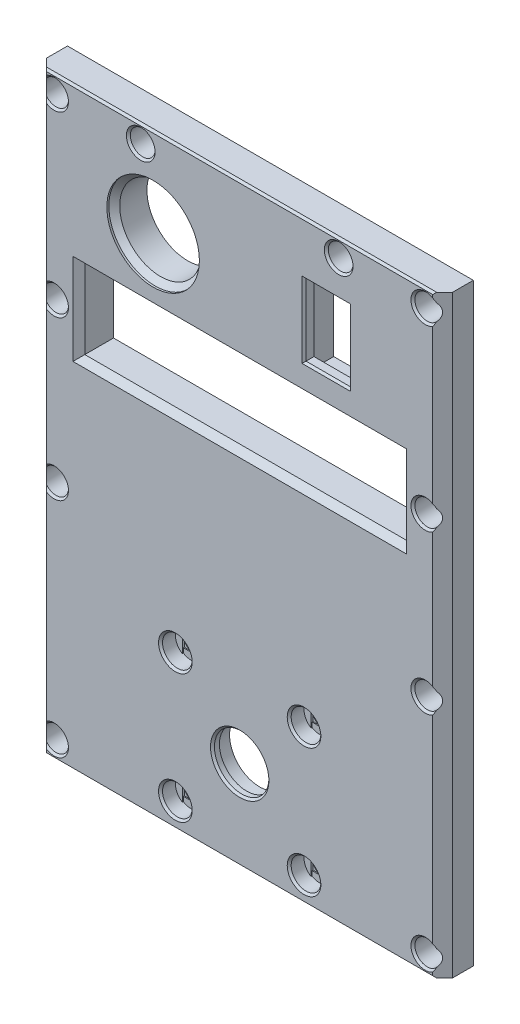
from build123d import *
from build123d.topology import SkipClean

# Parameters (mm, degrees)
SKETCH1_W                = 82
SKETCH1_H                = 120
SKETCH1_W_2              = 68
SKETCH1_H_2              = 106
BOSS_EXTRUDE1_DEPTH      = 7
SKETCH2_W                = 68
SKETCH2_H                = 36
BOSS_EXTRUDE2_DEPTH      = 7
SKETCH3_R                = 5.5
CUT_EXTRUDE1_DEPTH       = 74.006848994
SKETCH4_R                = 6.05
CUT_EXTRUDE2_DEPTH       = 5.6
SKETCH5_R                = 11
CUT_EXTRUDE3_DEPTH       = 3
SKETCH6_R                = 1.6
CUT_EXTRUDE4_DEPTH       = 74.006848994
SKETCH7_W                = 50
SKETCH7_H                = 38
CUT_EXTRUDE5_DEPTH       = 1
SKETCH8_R                = 3
CUT_EXTRUDE6_DEPTH       = 3
SKETCH9_R                = 1.5
CUT_EXTRUDE7_DEPTH       = 74.006848994
SKETCH10_R               = 2.5
CUT_EXTRUDE8_DEPTH       = 5
CHAMFER1_SIZE            = 2
SKETCH11_W               = 68
SKETCH11_H               = 19
BOSS_EXTRUDE3_DEPTH      = 7
SKETCH12_R               = 1.5
CUT_EXTRUDE9_DEPTH       = 74.006848994
SKETCH13_R               = 2.5
CUT_EXTRUDE10_DEPTH      = 5
CHAMFER2_SIZE            = 0.8
CUT_EXTRUDE11_DEPTH      = 0.2
SKETCH15_W               = 3
SKETCH15_H               = 3
CUT_EXTRUDE12_DEPTH      = 0.2
CUT_EXTRUDE13_DEPTH      = 0.2
SKETCH17_W               = 3.2
SKETCH17_H               = 3.2
CUT_EXTRUDE14_DEPTH      = 0.2
SKETCH18_W               = 69.6
SKETCH18_H               = 52.6
BOSS_EXTRUDE4_DEPTH      = 7
CUT_EXTRUDE15_DEPTH      = 74.006848994
CUT_EXTRUDE15_DEPTH_BACK = 74.006848994
SKETCH19_R               = 8.25
SKETCH19_W               = 9
SKETCH19_H               = 14.5
SKETCH20_W               = 11
SKETCH20_H               = 20.5
CUT_EXTRUDE16_DEPTH      = 5
SKETCH21_W               = 65
SKETCH21_H               = 16
CUT_EXTRUDE17_DEPTH      = 74.006848994
SKETCH22_R               = 9.35
CUT_EXTRUDE18_DEPTH      = 1.6
CHAMFER3_SIZE            = 1.2
CHAMFER4_SIZE            = 1.2
CHAMFER5_SIZE            = 0.4
CHAMFER6_SIZE            = 0.4


with BuildPart() as part:
    # Sketch1 → Boss-Extrude1 (new body)
    with BuildSketch(Plane.XY):
        Rectangle(SKETCH1_W, SKETCH1_H)
        Rectangle(SKETCH1_W_2, SKETCH1_H_2, mode=Mode.SUBTRACT)
    extrude(amount=BOSS_EXTRUDE1_DEPTH)

    # Sketch2 → Boss-Extrude2 (add)
    with BuildSketch(Plane.XY.offset(7)):
        with Locations((0, -35)):
            Rectangle(SKETCH2_W, SKETCH2_H)
    extrude(amount=-BOSS_EXTRUDE2_DEPTH)

    # Sketch3 → Cut-Extrude1 (cut, through all)
    with BuildSketch(Plane(origin=(0, 0, 0), x_dir=(-1, 0, 0), z_dir=(0, 0, -1))):
        with Locations((0, -42)):
            Circle(SKETCH3_R)
    extrude(amount=-CUT_EXTRUDE1_DEPTH, mode=Mode.SUBTRACT)

    # Sketch4 → Cut-Extrude2 (cut)
    with BuildSketch(Plane(origin=(0, 0, 0), x_dir=(-1, 0, 0), z_dir=(0, 0, -1))):
        with Locations((0, -42)):
            Circle(SKETCH4_R)
    extrude(amount=-CUT_EXTRUDE2_DEPTH, mode=Mode.SUBTRACT)

    # Sketch5 → Cut-Extrude3 (cut)
    with BuildSketch(Plane(origin=(0, 0, 0), x_dir=(-1, 0, 0), z_dir=(0, 0, -1))):
        with Locations((0, -42)):
            Circle(SKETCH5_R)
    extrude(amount=-CUT_EXTRUDE3_DEPTH, mode=Mode.SUBTRACT)

    # Sketch6 → Cut-Extrude4 (cut, through all)
    with BuildSketch(Plane(origin=(0, 0, 0), x_dir=(-1, 0, 0), z_dir=(0, 0, -1))):
        with Locations((-13, -29)):
            Circle(SKETCH6_R)
        with Locations((13, -29)):
            Circle(SKETCH6_R)
        with Locations((13, -55)):
            Circle(SKETCH6_R)
        with Locations((-13, -55)):
            Circle(SKETCH6_R)
    extrude(amount=-CUT_EXTRUDE4_DEPTH, mode=Mode.SUBTRACT)

    # Sketch7 → Cut-Extrude5 (cut)
    with BuildSketch(Plane(origin=(0, 0, 0), x_dir=(-1, 0, 0), z_dir=(0, 0, -1))):
        with Locations((0, -42)):
            Rectangle(SKETCH7_W, SKETCH7_H)
    extrude(amount=-CUT_EXTRUDE5_DEPTH, mode=Mode.SUBTRACT)

    # Sketch8 → Cut-Extrude6 (cut)
    with BuildSketch(Plane.XY.offset(7)):
        with Locations((-13, -29)):
            Circle(SKETCH8_R)
        with Locations((13, -29)):
            Circle(SKETCH8_R)
        with Locations((13, -55)):
            Circle(SKETCH8_R)
        with Locations((-13, -55)):
            Circle(SKETCH8_R)
    extrude(amount=-CUT_EXTRUDE6_DEPTH, mode=Mode.SUBTRACT)

    # Sketch9 → Cut-Extrude7 (cut, through all)
    with BuildSketch(Plane.XY.offset(7)):
        with Locations((-37.5, 56.5)):
            Circle(SKETCH9_R)
        with Locations((37.5, 56.5)):
            Circle(SKETCH9_R)
        with Locations((-37.5, -56.5)):
            Circle(SKETCH9_R)
        with Locations((37.5, -56.5)):
            Circle(SKETCH9_R)
        with Locations((-37.5, 20.5)):
            Circle(SKETCH9_R)
        with Locations((37.5, 20.5)):
            Circle(SKETCH9_R)
        with Locations((37.5, -11.5)):
            Circle(SKETCH9_R)
        with Locations((-37.5, -11.5)):
            Circle(SKETCH9_R)
    extrude(amount=-CUT_EXTRUDE7_DEPTH, mode=Mode.SUBTRACT)

    # Sketch10 → Cut-Extrude8 (cut)
    with BuildSketch(Plane.XY.offset(7)):
        with Locations((-37.5, 56.5)):
            Circle(SKETCH10_R)
        with Locations((37.5, 20.5)):
            Circle(SKETCH10_R)
        with Locations((-37.5, 20.5)):
            Circle(SKETCH10_R)
        with Locations((37.5, 56.5)):
            Circle(SKETCH10_R)
        with Locations((-37.5, -56.5)):
            Circle(SKETCH10_R)
        with Locations((37.5, -56.5)):
            Circle(SKETCH10_R)
        with Locations((-37.5, -11.5)):
            Circle(SKETCH10_R)
        with Locations((37.5, -11.5)):
            Circle(SKETCH10_R)
    extrude(amount=-CUT_EXTRUDE8_DEPTH, mode=Mode.SUBTRACT)

    # Chamfer1
    # the kernel refuses this chamfer: 2 mm, written as the material it takes off along each edge
    with BuildSketch(Plane(origin=(-41, 65.143365976, 7), x_dir=(0.9996219169112968, 0, 0.02749587661058651), z_dir=(0, -1, 0))) as chamfer1_piece_1:
        Polygon((CHAMFER1_SIZE * 0.999621916911, -CHAMFER1_SIZE * 0.0274958766106), (-CHAMFER1_SIZE * 0.0274958766106, -CHAMFER1_SIZE * 0.999621916911), (0, 0), align=None)
    extrude(amount=130.286731952, mode=Mode.SUBTRACT)
    with BuildSketch(Plane(origin=(41, -65.143365976, 7), x_dir=(0.027495876610585623, 0, -0.9996219169112968), z_dir=(0, 1, 0))) as chamfer1_piece_2:
        Polygon((CHAMFER1_SIZE * 0.999621916911, CHAMFER1_SIZE * 0.0274958766106), (-CHAMFER1_SIZE * 0.0274958766106, CHAMFER1_SIZE * 0.999621916911), (0, 0), align=None)
    extrude(amount=130.286731952, mode=Mode.SUBTRACT)

    # Sketch11 → Boss-Extrude3 (add)
    with BuildSketch(Plane.XY.offset(7)):
        with Locations((0, -7.5)):
            Rectangle(SKETCH11_W, SKETCH11_H)
    extrude(amount=-BOSS_EXTRUDE3_DEPTH)

    # Sketch12 → Cut-Extrude9 (cut, through all)
    with BuildSketch(Plane.XY.offset(7)):
        with Locations((-20, 56.5)):
            Circle(SKETCH12_R)
        with Locations((20, 56.5)):
            Circle(SKETCH12_R)
    extrude(amount=-CUT_EXTRUDE9_DEPTH, mode=Mode.SUBTRACT)

    # Sketch13 → Cut-Extrude10 (cut)
    with BuildSketch(Plane.XY.offset(7)):
        with Locations((-20, 56.5)):
            Circle(SKETCH13_R)
        with Locations((20, 56.5)):
            Circle(SKETCH13_R)
    extrude(amount=-CUT_EXTRUDE10_DEPTH, mode=Mode.SUBTRACT)

    # Chamfer2
    chamfer2_edges = [part.edges().sort_by_distance(p)[0] for p in [
        (0, 53, 0),
        (-34, 27.5, 0),
        (0, 53, 7),
        (-34, 27.5, 7),
        (34, 27.5, 7),
        (34, 27.5, 0),
        (0, 2, 7),
        (0, 2, 0),
        (-33, -60, 0),
        (-41, 0, 0),
        (0, 60, 0),
        (41, 0, 0),
        (33, -60, 0),
        (0, -60, 1),
    ]]
    chamfer(chamfer2_edges, length=CHAMFER2_SIZE)

    # Sketch14 → Cut-Extrude11 (cut)
    with SkipClean():  # the faces are left unmerged after this step: merging them gives an invalid solid
        with BuildSketch(Plane.XY.offset(2)):
            with BuildLine():
                Line((-39, -13.5), (-39, -9.5))
                ThreePointArc((-39, -9.5), (-37.5, -9), (-36, -9.5))
                Line((-36, -9.5), (-36, -13.5))
                ThreePointArc((-36, -13.5), (-37.5, -14), (-39, -13.5))
            make_face()
            with BuildLine():
                Line((-39, -58.5), (-39, -54.5))
                ThreePointArc((-39, -54.5), (-37.5, -54), (-36, -54.5))
                Line((-36, -54.5), (-36, -58.5))
                ThreePointArc((-36, -58.5), (-37.5, -59), (-39, -58.5))
            make_face()
            with BuildLine():
                Line((-39, 18.5), (-39, 22.5))
                ThreePointArc((-39, 22.5), (-37.5, 23), (-36, 22.5))
                Line((-36, 22.5), (-36, 18.5))
                ThreePointArc((-36, 18.5), (-37.5, 18), (-39, 18.5))
            make_face()
            with BuildLine():
                Line((-21.5, 54.5), (-21.5, 58.5))
                ThreePointArc((-21.5, 58.5), (-20, 59), (-18.5, 58.5))
                Line((-18.5, 58.5), (-18.5, 54.5))
                ThreePointArc((-18.5, 54.5), (-20, 54), (-21.5, 54.5))
            make_face()
            with BuildLine():
                Line((-39, 54.5), (-39, 58.5))
                ThreePointArc((-39, 58.5), (-37.5, 59), (-36, 58.5))
                Line((-36, 58.5), (-36, 54.5))
                ThreePointArc((-36, 54.5), (-37.5, 54), (-39, 54.5))
            make_face()
        cut_extrude11 = extrude(amount=-CUT_EXTRUDE11_DEPTH, mode=Mode.SUBTRACT)
    add(part.part.scale(1), mode=Mode.REPLACE)  # the faces are merged on a copy

    # Sketch15 → Cut-Extrude12 (cut)
    with BuildSketch(Plane.XY.offset(1.8)):
        with Locations((-37.5, -56.5)):
            Rectangle(SKETCH15_W, SKETCH15_H)
        with Locations((-37.5, -11.5)):
            Rectangle(SKETCH15_W, SKETCH15_H)
        with Locations((-37.5, 20.5)):
            Rectangle(SKETCH15_W, SKETCH15_H)
        with Locations((-37.5, 56.5)):
            Rectangle(SKETCH15_W, SKETCH15_H)
        with Locations((-20, 56.5)):
            Rectangle(SKETCH15_W, SKETCH15_H)
    cut_extrude12 = extrude(amount=-CUT_EXTRUDE12_DEPTH, mode=Mode.SUBTRACT)

    # Sketch16 → Cut-Extrude13 (cut)
    with BuildSketch(Plane.XY.offset(4)):
        with BuildLine():
            Line((-14.6, -31.537715508), (-14.6, -26.462284492))
            ThreePointArc((-14.6, -26.462284492), (-13, -26), (-11.4, -26.462284492))
            Line((-11.4, -26.462284492), (-11.4, -31.537715508))
            ThreePointArc((-11.4, -31.537715508), (-13, -32), (-14.6, -31.537715508))
        make_face()
        with BuildLine():
            Line((-14.6, -57.537715508), (-14.6, -52.462284492))
            ThreePointArc((-14.6, -52.462284492), (-13, -52), (-11.4, -52.462284492))
            Line((-11.4, -52.462284492), (-11.4, -57.537715508))
            ThreePointArc((-11.4, -57.537715508), (-13, -58), (-14.6, -57.537715508))
        make_face()
    cut_extrude13 = extrude(amount=-CUT_EXTRUDE13_DEPTH, mode=Mode.SUBTRACT)

    # Sketch17 → Cut-Extrude14 (cut)
    with BuildSketch(Plane.XY.offset(3.8)):
        with Locations((-13, -29)):
            Rectangle(SKETCH17_W, SKETCH17_H)
        with Locations((-13, -55)):
            Rectangle(SKETCH17_W, SKETCH17_H)
    cut_extrude14 = extrude(amount=-CUT_EXTRUDE14_DEPTH, mode=Mode.SUBTRACT)

    # Mirror1: Cut-Extrude11, Cut-Extrude12, Cut-Extrude13, Cut-Extrude14 across plane
    add(cut_extrude11.mirror(Plane(origin=(0, 0, 0), x_dir=(0, 0, 1), z_dir=(1, 0, 0))), mode=Mode.SUBTRACT)
    add(cut_extrude12.mirror(Plane(origin=(0, 0, 0), x_dir=(0, 0, 1), z_dir=(1, 0, 0))), mode=Mode.SUBTRACT)
    add(cut_extrude13.mirror(Plane(origin=(0, 0, 0), x_dir=(0, 0, 1), z_dir=(1, 0, 0))), mode=Mode.SUBTRACT)
    add(cut_extrude14.mirror(Plane(origin=(0, 0, 0), x_dir=(0, 0, 1), z_dir=(1, 0, 0))), mode=Mode.SUBTRACT)

    # Sketch18 → Boss-Extrude4 (add)
    with BuildSketch(Plane(origin=(0, 0, 0), x_dir=(-1, 0, 0), z_dir=(0, 0, -1))):
        with Locations((0, 27.5)):
            Rectangle(SKETCH18_W, SKETCH18_H)
    extrude(amount=-BOSS_EXTRUDE4_DEPTH)

    # Sketch19 → Cut-Extrude15 (cut, two sides: drawn at the far end of the back side and taken through both)
    with BuildSketch(Plane.XY.offset(7).offset(-CUT_EXTRUDE15_DEPTH_BACK)):
        with Locations((-17.5, 42)):
            Circle(SKETCH19_R)
        with Locations((17.5, 42)):
            Rectangle(SKETCH19_W, SKETCH19_H)
    extrude(amount=CUT_EXTRUDE15_DEPTH + CUT_EXTRUDE15_DEPTH_BACK, mode=Mode.SUBTRACT)

    # Sketch20 → Cut-Extrude16 (cut)
    with BuildSketch(Plane(origin=(0, 0, 0), x_dir=(-1, 0, 0), z_dir=(0, 0, -1))):
        with Locations((-17.5, 42)):
            Rectangle(SKETCH20_W, SKETCH20_H)
    extrude(amount=-CUT_EXTRUDE16_DEPTH, mode=Mode.SUBTRACT)

    # Sketch21 → Cut-Extrude17 (cut, through all)
    with BuildSketch(Plane(origin=(0, 0, 0), x_dir=(-1, 0, 0), z_dir=(0, 0, -1))):
        with Locations((0, 20.75)):
            Rectangle(SKETCH21_W, SKETCH21_H)
    extrude(amount=-CUT_EXTRUDE17_DEPTH, mode=Mode.SUBTRACT)

    # Sketch22 → Cut-Extrude18 (cut)
    with BuildSketch(Plane.XY.offset(7)):
        with Locations((-17.5, 42)):
            Circle(SKETCH22_R)
    extrude(amount=-CUT_EXTRUDE18_DEPTH, mode=Mode.SUBTRACT)

    # Chamfer3
    # the kernel refuses this chamfer: 1.2 mm, written as the material it adds along each edge
    with BuildSketch(Plane(origin=(-17.5, 42, 5.4), x_dir=(1, 0, 0), z_dir=(0, -1, 0))) as chamfer3_piece_1_section:
        Polygon((9.35, CHAMFER3_SIZE), (9.35 - CHAMFER3_SIZE, 0), (9.35, 0), align=None)
    chamfer3_piece_1 = revolve(axis=Axis((-17.5, 42, 5.4), (0, 0, 1)), mode=Mode.PRIVATE)
    chamfer3_piece_1 = chamfer3_piece_1 - Plane(origin=(-17.5, 42, 6.042009959), x_dir=(1, 0, 0), z_dir=(0, 0, 1)) * Cylinder(8.25, 38, mode=Mode.PRIVATE)
    add(chamfer3_piece_1)

    # Chamfer4
    chamfer4_edges = [part.edges().sort_by_distance(p)[0] for p in [
        (-32.5, 20.75, 7),
        (0, 12.75, 7),
        (32.5, 20.75, 7),
        (0, 28.75, 7),
    ]]
    chamfer(chamfer4_edges, length=CHAMFER4_SIZE)

    # Chamfer5
    chamfer5_edges = [part.edges().sort_by_distance(p)[0] for p in [
        (0, 60, 7),
        (0, -60, 7),
    ]]
    chamfer(chamfer5_edges, length=CHAMFER5_SIZE)

    # Chamfer6
    chamfer6_edges = [part.edges().sort_by_distance(p)[0] for p in [
        (5.5, -42, 7),
        (17.5, 34.75, 7),
        (13, 42, 7),
        (22, 42, 7),
        (17.5, 49.25, 7),
        (-36.381966011, 58.736067977, 7),
        (-22.5, 56.5, 7),
        (17.5, 56.5, 7),
        (35, 56.5, 7),
        (35, -56.5, 7),
        (35, 20.5, 7),
        (35, -11.5, 7),
        (-36.381966011, -58.736067977, 7),
        (-16, -55, 7),
        (10, -55, 7),
        (10, -29, 7),
        (-16, -29, 7),
        (-36.381966011, -13.736067977, 7),
        (-36.381966011, 22.736067977, 7),
    ]]
    chamfer(chamfer6_edges, length=CHAMFER6_SIZE)


solid = part.part
